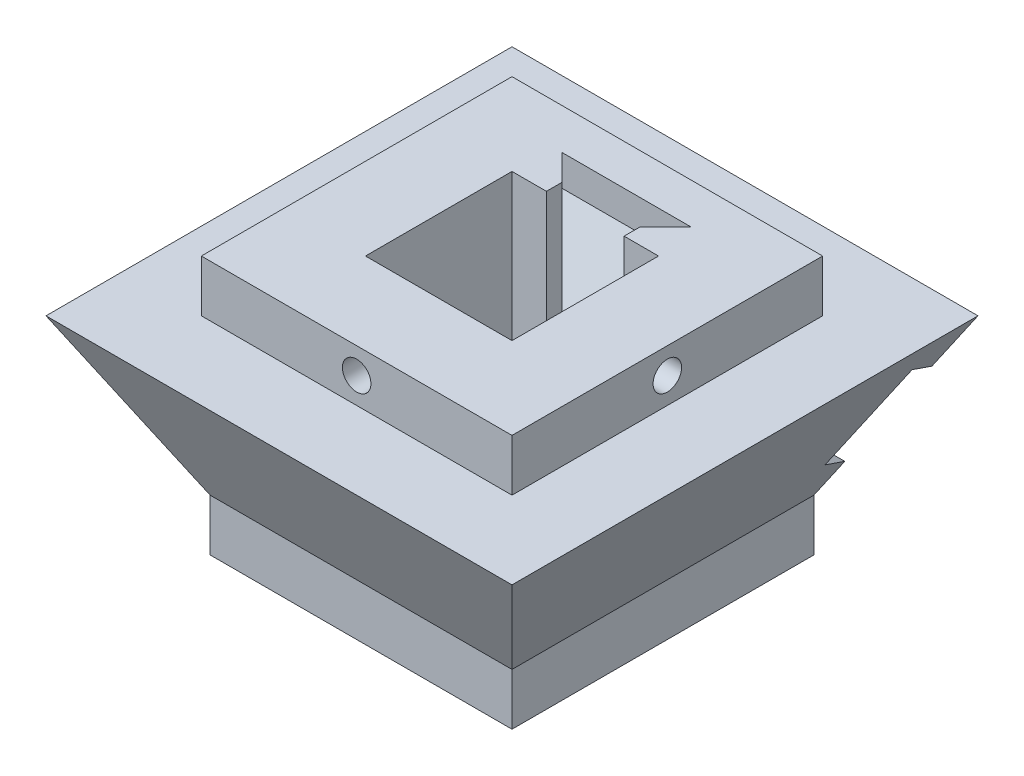
from build123d import *

# Parameters (mm, degrees)
SKETCH1_W           = 58.3
SKETCH1_H           = 58.3
SKETCH1_W_2         = 28.3
SKETCH1_H_2         = 28.3
BOSS_EXTRUDE1_DEPTH = 10
SKETCH4_W           = 60
SKETCH4_H           = 60
BOSS_EXTRUDE2_DEPTH = 10
SKETCH6_W           = 60
SKETCH6_H           = 26.8
ESP32_DEPTH         = 6
SKETCH8_W           = 28.3
SKETCH8_H           = 28.3
CUT_EXTRUDE3_DEPTH  = 48
SKETCH10_W          = 30
SKETCH10_H          = 5
CUT_EXTRUDE5_DEPTH  = 50
CUT_EXTRUDE2_REACH  = 95.195
SKETCH7_W           = 50
SKETCH7_H           = 3.2
CUT_EXTRUDE6_START  = -10
CUT_EXTRUDE6_DEPTH  = 71.932070392
CUT_EXTRUDE7_START  = -25
CUT_EXTRUDE7_DEPTH  = 50
CUT_EXTRUDE8_REACH  = 102.747
SKETCH14_W          = 15
SKETCH14_H          = 3
CUT_EXTRUDE9_DEPTH  = 48
CHAMFER1_SIZE       = 7.5
CUT_EXTRUDE10_REACH = 81.712
SKETCH15_R          = 2.65
SKETCH16_W          = 15.4
SKETCH16_H          = 16.6
CANBUS_DEPTH        = 3
SKETCH18_R          = 1.05
M2_CANBUS_DEPTH     = 6
SKETCH19_R          = 2.75
CUT_EXTRUDE13_DEPTH = 8
SKETCH20_R          = 2.75
CUT_EXTRUDE14_DEPTH = 8
SKETCH21_R          = 2.75
CUT_EXTRUDE15_DEPTH = 8
CUT_EXTRUDE16_START = -8
SKETCH22_R          = 2.75
CUT_EXTRUDE16_DEPTH = 8


# Read off the part's stored shape, not the designer's step: Cut-Extrude7
with BuildPart() as part:
    # Sketch1 → Boss-Extrude1 (new body)
    # profile 1 of 2: a face of its own
    with BuildSketch(Plane(origin=(0, 0, 0), x_dir=(1, 0, 0), z_dir=(0, 1, 0))):
        Rectangle(SKETCH1_W, SKETCH1_H)
        Rectangle(SKETCH1_W_2, SKETCH1_H_2, mode=Mode.SUBTRACT)
    # profile 2 of 2: a face of its own
    with BuildSketch(Plane(origin=(0, 0, 0), x_dir=(1, 0, 0), z_dir=(0, 1, 0))):
        Rectangle(SKETCH1_W_2, SKETCH1_H_2)
    extrude(amount=BOSS_EXTRUDE1_DEPTH)

    # Sketch2 → section 1 of loft1
    with BuildSketch(Plane(origin=(0, 40, 0), x_dir=(1, 0, 0), z_dir=(0, 1, 0)), mode=Mode.PRIVATE) as loft1_s1:
        with BuildLine():
            Line((-45, -45), (45, -45))
            Line((45, -45), (45, 45))
            Line((45, 45), (-45, 45))
            Line((-45, 45), (-45, -45))
        make_face()
    # loft from a face of the part (loft1)
    loft([part.faces().sort_by_distance((0, 10, 0))[0], loft1_s1.sketch])

    # Sketch4 → Boss-Extrude2 (add)
    with BuildSketch(Plane(origin=(0, 40, 0), x_dir=(1, 0, 0), z_dir=(0, 1, 0))):
        Rectangle(SKETCH4_W, SKETCH4_H)
    extrude(amount=BOSS_EXTRUDE2_DEPTH)

    # Sketch6 → ESP32 (cut)
    with BuildSketch(Plane(origin=(0, -9.857868483, -18.658426151), x_dir=(-1, 0, 0), z_dir=(0, -0.4671427704257183, -0.8841818998594039))):
        with Locations((0, 37.859030757)):
            Rectangle(SKETCH6_W, SKETCH6_H)
    extrude(amount=-ESP32_DEPTH, mode=Mode.SUBTRACT)

    # Sketch8 → Cut-Extrude3 (cut)
    with BuildSketch(Plane(origin=(0, 50, 0), x_dir=(1, 0, 0), z_dir=(0, 1, 0))):
        Rectangle(SKETCH8_W, SKETCH8_H)
    extrude(amount=-CUT_EXTRUDE3_DEPTH, mode=Mode.SUBTRACT)

    # Sketch10 → Cut-Extrude5 (cut)
    with BuildSketch(Plane(origin=(0, 0, 0), x_dir=(-1, 0, 0), z_dir=(0, -1, 0))):
        with Locations((0, 19.65)):
            Rectangle(SKETCH10_W, SKETCH10_H)
    extrude(amount=-CUT_EXTRUDE5_DEPTH, mode=Mode.SUBTRACT)

    # Cut-Extrude2: up to this plane
    cut_extrude2_end = Plane(origin=(-15, 50, -22.15), z_dir=(0, 0, -1))
    # Sketch7 → Cut-Extrude2 (cut, up to the surface)
    with BuildSketch(Plane(origin=(0, -7.055011861, -13.353334752), x_dir=(-1, 0, 0), z_dir=(0, -0.46714277042571845, -0.8841818998594037)), mode=Mode.PRIVATE) as cut_extrude2_sk1:
        with Locations((0, 47.659030757)):
            Rectangle(SKETCH7_W, SKETCH7_H)
    cut_extrude2_tool1 = split(extrude(cut_extrude2_sk1.sketch, amount=-CUT_EXTRUDE2_REACH, mode=Mode.PRIVATE), bisect_by=cut_extrude2_end, keep=Keep.BOTH, mode=Mode.PRIVATE)
    add(cut_extrude2_tool1.solids().sort_by_distance((0, 35.08424, -35.616906))[0], mode=Mode.SUBTRACT)
    # Sketch7 → Cut-Extrude2 (cut, up to the surface)
    with BuildSketch(Plane(origin=(0, -7.055011861, -13.353334752), x_dir=(-1, 0, 0), z_dir=(0, -0.46714277042571845, -0.8841818998594037)), mode=Mode.PRIVATE) as cut_extrude2_sk2:
        with Locations((0, 28.059030757)):
            Rectangle(SKETCH7_W, SKETCH7_H)
    cut_extrude2_tool2 = split(extrude(cut_extrude2_sk2.sketch, amount=-CUT_EXTRUDE2_REACH, mode=Mode.PRIVATE), bisect_by=cut_extrude2_end, keep=Keep.BOTH, mode=Mode.PRIVATE)
    add(cut_extrude2_tool2.solids().sort_by_distance((0, 17.754275, -26.460908))[0], mode=Mode.SUBTRACT)

    # Sketch11 → Cut-Extrude6 (cut, through all)
    with BuildSketch(Plane(origin=(0, 50, 0), x_dir=(1, 0, 0), z_dir=(0, 1, 0)).offset(CUT_EXTRUDE6_START)):
        Polygon((-25, 22.15), (25, 22.15), (15, 17.15), (-15, 17.15), align=None)
    extrude(amount=-CUT_EXTRUDE6_DEPTH, mode=Mode.SUBTRACT)

    # Cut-Extrude7 outline → Cut-Extrude7 (cut)
    with BuildSketch(Plane.YZ.offset(CUT_EXTRUDE7_START)):
        Polygon((40.38967366, -22.15), (21.841454111, -22.15), (21.504680154, -22.787427049), (36.005263311, -30.448568484), align=None)
    extrude(amount=CUT_EXTRUDE7_DEPTH, mode=Mode.SUBTRACT)

    # Cut-Extrude8: up to this plane
    cut_extrude8_end = Plane(origin=(18.658426151, -9.857868483, 0), z_dir=(-0.884181899859404, 0.4671427704257181, 0))
    # Sketch13 → Cut-Extrude8 (cut, up to the surface)
    with BuildSketch(Plane.ZY.offset(-30), mode=Mode.PRIVATE) as cut_extrude8_sk1:
        Polygon((-32.139713731, 15.658764159), (-40.548283598, 31.574038357), (-35.243192199, 34.376894979), (-26.834622332, 18.461620782), align=None)
    cut_extrude8_tool1 = split(extrude(cut_extrude8_sk1.sketch, amount=-CUT_EXTRUDE8_REACH, mode=Mode.PRIVATE), bisect_by=cut_extrude8_end, keep=Keep.BOTH, mode=Mode.PRIVATE)
    add(cut_extrude8_tool1.solids().sort_by_distance((30, 25.01783, -33.691453))[0], mode=Mode.SUBTRACT)

    # Sketch14 → Cut-Extrude9 (cut)
    with BuildSketch(Plane(origin=(0, 50, 0), x_dir=(1, 0, 0), z_dir=(0, 1, 0))):
        with Locations((0, 15.65)):
            Rectangle(SKETCH14_W, SKETCH14_H)
    extrude(amount=-CUT_EXTRUDE9_DEPTH, mode=Mode.SUBTRACT)

    # Chamfer1
    # the kernel refuses this chamfer: 7.5 mm, written as the material it adds along each edge
    with BuildSketch(Plane(origin=(15, 40, -17.15), x_dir=(-0.9996219169112968, 0, 0.02749587661058632), z_dir=(0, 1, 0))) as chamfer1_piece_1_section:
        Polygon((CHAMFER1_SIZE * 0.999621916911, -CHAMFER1_SIZE * 0.0274958766106), (-CHAMFER1_SIZE * 0.0274958766106, -CHAMFER1_SIZE * 0.999621916911), (0, 0), align=None)
    chamfer1_piece_1 = extrude(amount=10, mode=Mode.PRIVATE)
    chamfer1_piece_1 = split(chamfer1_piece_1, bisect_by=Plane(origin=(12.200765376, 42.822931518, -22.15), z_dir=(0, 0, 1)), keep=Keep.TOP, mode=Mode.PRIVATE)
    add(chamfer1_piece_1)
    with BuildSketch(Plane(origin=(-15, 40, -17.15), x_dir=(0.9996219169112968, 0, 0.02749587661058632), z_dir=(0, 1, 0))) as chamfer1_piece_2_section:
        Polygon((CHAMFER1_SIZE * 0.999621916911, CHAMFER1_SIZE * 0.0274958766106), (-CHAMFER1_SIZE * 0.0274958766106, CHAMFER1_SIZE * 0.999621916911), (0, 0), align=None)
    chamfer1_piece_2 = extrude(amount=10, mode=Mode.PRIVATE)
    chamfer1_piece_2 = split(chamfer1_piece_2, bisect_by=Plane(origin=(-12.200765376, 42.822931518, -22.15), z_dir=(0, 0, 1)), keep=Keep.TOP, mode=Mode.PRIVATE)
    add(chamfer1_piece_2)

    # Sketch15 → Cut-Extrude10 (cut, up to next)
    with BuildSketch(Plane(origin=(0, 2, 0), x_dir=(1, 0, 0), z_dir=(0, 1, 0)), mode=Mode.PRIVATE) as cut_extrude10_sk1:
        with Locations(Location((0, 0, 0), (0, 0, 270))):
            Circle(SKETCH15_R)
    cut_extrude10_tool1 = extrude(cut_extrude10_sk1.sketch, amount=-CUT_EXTRUDE10_REACH, mode=Mode.PRIVATE) & part.part
    add(cut_extrude10_tool1.solids().sort_by_distance((0, 2, 0))[0], mode=Mode.SUBTRACT)

    # Sketch16 → CANbus (cut)
    with BuildSketch(Plane(origin=(-18.658426151, -9.857868483, 0), x_dir=(0, 0, 1), z_dir=(-0.8841818998594037, -0.46714277042571845, 0))):
        with Locations((0, 40.759030757)):
            Rectangle(SKETCH16_W, SKETCH16_H)
    extrude(amount=-CANBUS_DEPTH, mode=Mode.SUBTRACT)

    # Sketch18 → M2-CANbus (cut)
    with BuildSketch(Plane(origin=(-16.005880452, -8.456440172, 0), x_dir=(0, 0, 1), z_dir=(-0.8841818998594035, -0.46714277042571867, 0))):
        with Locations(Location((5.2, 45.898343703, 0), (0, 0, 270))):
            Circle(SKETCH18_R)
        with Locations(Location((5.2, 34.898343703, 0), (0, 0, 270))):
            Circle(SKETCH18_R)
    extrude(amount=-M2_CANBUS_DEPTH, mode=Mode.SUBTRACT)

    # Sketch19 → Cut-Extrude13 (cut)
    with BuildSketch(Plane(origin=(0, 0, -30), x_dir=(-1, 0, 0), z_dir=(0, 0, -1))):
        with Locations((-22.5, 45)):
            Circle(SKETCH19_R)
        with Locations((22.5, 45)):
            Circle(SKETCH19_R)
    extrude(amount=-CUT_EXTRUDE13_DEPTH, mode=Mode.SUBTRACT)

    # Sketch20 → Cut-Extrude14 (cut)
    with BuildSketch(Plane(origin=(30, 0, 0), x_dir=(0, 0, -1), z_dir=(1, 0, 0))):
        with Locations((0, 45)):
            Circle(SKETCH20_R)
    extrude(amount=-CUT_EXTRUDE14_DEPTH, mode=Mode.SUBTRACT)

    # Sketch21 → Cut-Extrude15 (cut)
    with BuildSketch(Plane.XY.offset(30)):
        with Locations((0, 45)):
            Circle(SKETCH21_R)
    extrude(amount=-CUT_EXTRUDE15_DEPTH, mode=Mode.SUBTRACT)

    # Sketch22 → Cut-Extrude16 (cut)
    with BuildSketch(Plane.ZY.offset(30).offset(CUT_EXTRUDE16_START)):
        with Locations(Location((0, 45, 0), (0, 0, 180))):
            Circle(SKETCH22_R)
    extrude(amount=CUT_EXTRUDE16_DEPTH, mode=Mode.SUBTRACT)


solid = part.part
